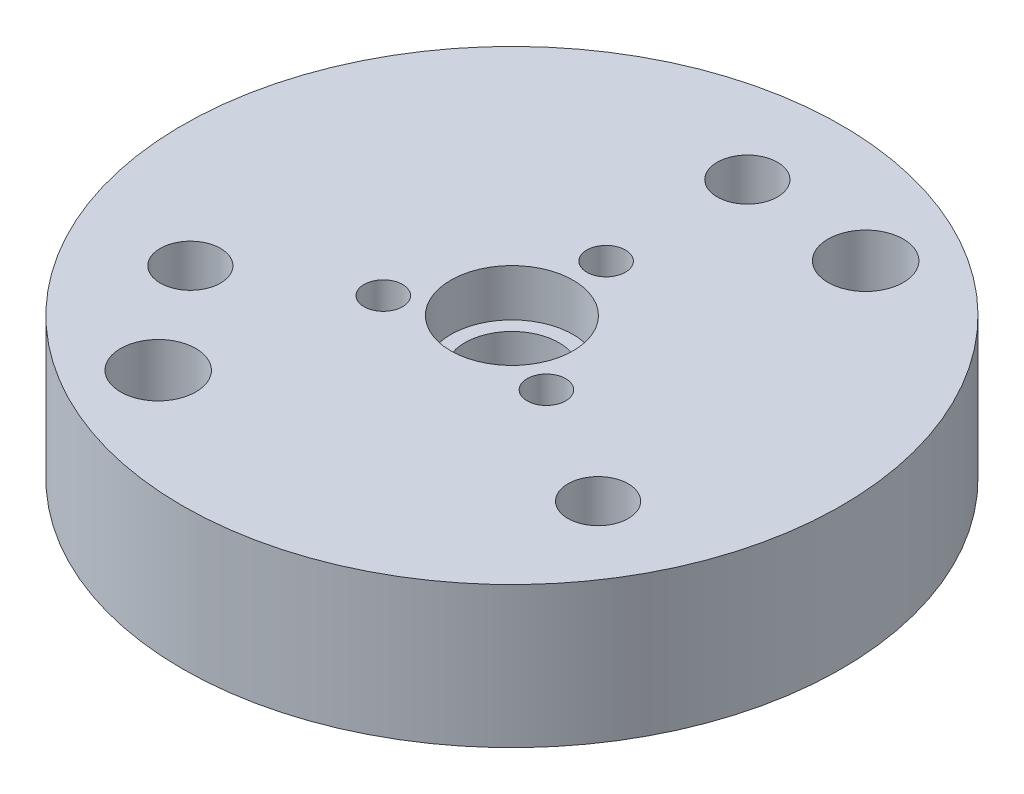
from build123d import *

# Parameters (mm, degrees)
SKETCH1_R             = 35
BOSS_EXTRUDE1_DEPTH   = 15
CUT_EXTRUDE1_REACH    = 53.72
SKETCH2_R             = 5
SKETCH3_R             = 6.5
CUT_EXTRUDE2_DEPTH    = 5
CUT_EXTRUDE3_REACH    = 53.72
SKETCH4_R             = 2.05
M6_CLEARANCE_HOLE1_D  = 6.4
F_8_0MM_DOWEL_HOLE1_D = 8


with BuildPart() as part:
    # Sketch1 → Boss-Extrude1 (new body)
    with BuildSketch(Plane(origin=(0, 0, 0), x_dir=(1, 0, 0), z_dir=(0, 1, 0))):
        Circle(SKETCH1_R)
    extrude(amount=BOSS_EXTRUDE1_DEPTH)

    # Sketch2 → Cut-Extrude1 (cut, up to next)
    with BuildSketch(Plane(origin=(0, 15, 0), x_dir=(1, 0, 0), z_dir=(0, 1, 0)), mode=Mode.PRIVATE) as cut_extrude1_sk1:
        Circle(SKETCH2_R)
    cut_extrude1_tool1 = extrude(cut_extrude1_sk1.sketch, amount=-CUT_EXTRUDE1_REACH, mode=Mode.PRIVATE) & part.part
    add(cut_extrude1_tool1.solids().sort_by_distance((0, 15, 0))[0], mode=Mode.SUBTRACT)

    # Sketch3 → Cut-Extrude2 (cut)
    with BuildSketch(Plane(origin=(0, 15, 0), x_dir=(1, 0, 0), z_dir=(0, 1, 0))):
        Circle(SKETCH3_R)
    extrude(amount=-CUT_EXTRUDE2_DEPTH, mode=Mode.SUBTRACT)

    # Sketch4 → Cut-Extrude3 (cut, up to next)
    with BuildSketch(Plane(origin=(0, 15, 0), x_dir=(1, 0, 0), z_dir=(0, 1, 0)), mode=Mode.PRIVATE) as cut_extrude3_sk1:
        with Locations((0, 10)):
            Circle(SKETCH4_R)
    cut_extrude3_tool1 = extrude(cut_extrude3_sk1.sketch, amount=-CUT_EXTRUDE3_REACH, mode=Mode.PRIVATE) & part.part
    # Sketch4 → Cut-Extrude3 (cut, up to next)
    with BuildSketch(Plane(origin=(0, 15, 0), x_dir=(1, 0, 0), z_dir=(0, 1, 0)), mode=Mode.PRIVATE) as cut_extrude3_sk2:
        with Locations((8.660254038, -5)):
            Circle(SKETCH4_R)
    cut_extrude3_tool2 = extrude(cut_extrude3_sk2.sketch, amount=-CUT_EXTRUDE3_REACH, mode=Mode.PRIVATE) & part.part
    # Sketch4 → Cut-Extrude3 (cut, up to next)
    with BuildSketch(Plane(origin=(0, 15, 0), x_dir=(1, 0, 0), z_dir=(0, 1, 0)), mode=Mode.PRIVATE) as cut_extrude3_sk3:
        with Locations((-8.660254038, -5)):
            Circle(SKETCH4_R)
    cut_extrude3_tool3 = extrude(cut_extrude3_sk3.sketch, amount=-CUT_EXTRUDE3_REACH, mode=Mode.PRIVATE) & part.part
    add(cut_extrude3_tool1.solids().sort_by_distance((0, 15, -10))[0], mode=Mode.SUBTRACT)
    add(cut_extrude3_tool2.solids().sort_by_distance((8.660254, 15, 5))[0], mode=Mode.SUBTRACT)
    add(cut_extrude3_tool3.solids().sort_by_distance((-8.660254, 15, 5))[0], mode=Mode.SUBTRACT)

    # M6 Clearance Hole1 (through all)
    with Locations(Plane(origin=(0, 0, 0), x_dir=(-1, 0, 0), z_dir=(0, -1, 0))):
        with Locations((0, 25), (21.650635095, -12.5), (-21.650635095, -12.5)):
            Hole(M6_CLEARANCE_HOLE1_D / 2)

    # Ø8.0mm Dowel Hole1 (through all)
    with Locations(Plane(origin=(0, 0, 0), x_dir=(-1, 0, 0), z_dir=(0, -1, 0))):
        with Locations((-13.75, 23.815698604), (13.75, -23.815698604)):
            Hole(F_8_0MM_DOWEL_HOLE1_D / 2)


solid = part.part
